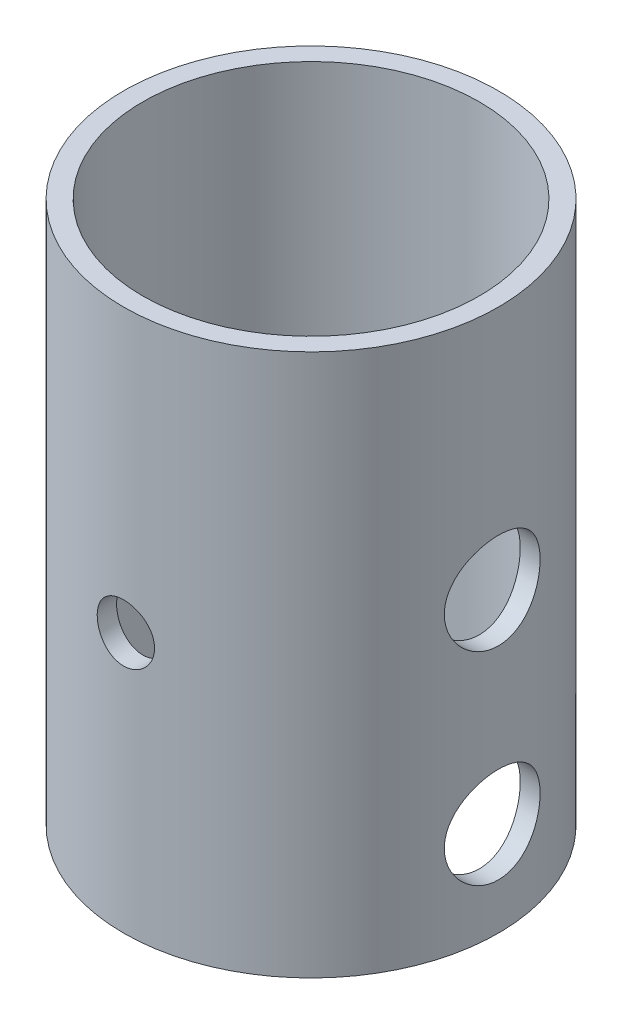
from build123d import *

# Parameters (mm, degrees)
SKETCH1_R           = 49
SKETCH1_R_2         = 44
BOSS_EXTRUDE1_DEPTH = 141.8
SKETCH2_R           = 12.53
CUT_EXTRUDE1_DEPTH  = 158.826613725
SKETCH4_R           = 7.5
CUT_EXTRUDE2_DEPTH  = 158.826613877
SKETCH5_R           = 7.5
CUT_EXTRUDE3_DEPTH  = 158.826613878


with BuildPart() as part:
    # Sketch1 → Boss-Extrude1 (new body)
    with BuildSketch(Plane(origin=(0, 0, 0), x_dir=(1, 0, 0), z_dir=(0, 1, 0))):
        Circle(SKETCH1_R)
        Circle(SKETCH1_R_2, mode=Mode.SUBTRACT)
    extrude(amount=BOSS_EXTRUDE1_DEPTH)

    # Sketch2 → Cut-Extrude1 (cut, through all)
    with BuildSketch(Plane(origin=(0, 0, 0), x_dir=(0, 0, -1), z_dir=(1, 0, 0))):
        with Locations((0, 24.6)):
            Circle(SKETCH2_R)
        with Locations((0, 77.6)):
            Circle(SKETCH2_R)
    extrude(amount=CUT_EXTRUDE1_DEPTH, mode=Mode.SUBTRACT)

    # Sketch4 → Cut-Extrude2 (cut, through all)
    with BuildSketch(Plane.XY):
        with Locations((0, 68)):
            Circle(SKETCH4_R)
    extrude(amount=CUT_EXTRUDE2_DEPTH, mode=Mode.SUBTRACT)

    # Sketch5 → Cut-Extrude3 (cut, through all)
    with BuildSketch(Plane.XY):
        with Locations((0, 73.8)):
            Circle(SKETCH5_R)
    extrude(amount=-CUT_EXTRUDE3_DEPTH, mode=Mode.SUBTRACT)


solid = part.part
